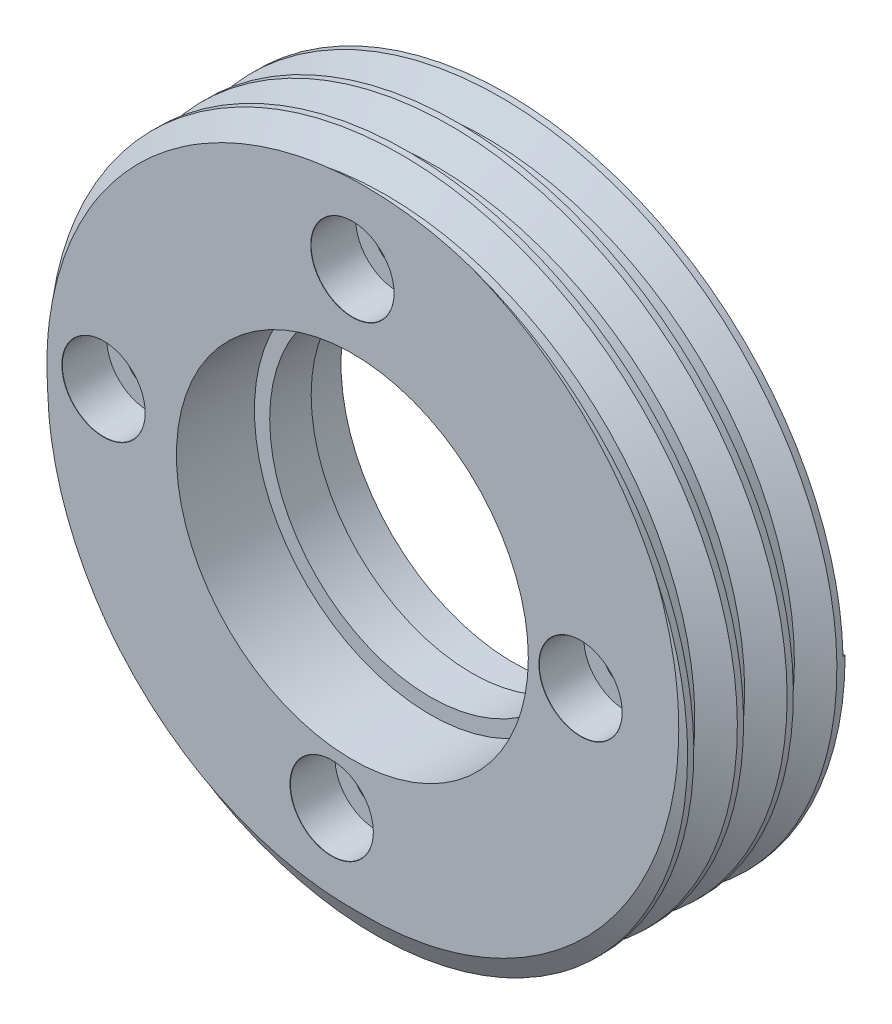
from build123d import *

# Parameters (mm, degrees)
SKETCH1_R                                    = 40
SKETCH1_R_2                                  = 20.7645
BOSS_EXTRUDE1_DEPTH                          = 5
SKETCH2_R                                    = 40
SKETCH2_R_2                                  = 19.3675
BOSS_EXTRUDE2_DEPTH                          = 5
SKETCH3_R                                    = 40
SKETCH3_R_2                                  = 21.209
BOSS_EXTRUDE3_DEPTH                          = 9.398
CBORE_FOR_M5_HEX_SOCKET_HEAD_CAP_SCR_2_COUNT = 2
CBORE_FOR_M5_HEX_SOCKET_HEAD_CAP_SCR_2_PITCH = 40.69705149
CBORE_FOR_M5_HEX_SOCKET_HEAD_CAP_SCR_3_COUNT = 2
CBORE_FOR_M5_HEX_SOCKET_HEAD_CAP_SCR_3_PITCH = 57.554322166
CBORE_FOR_M5_HEX_SOCKET_HEAD_CAP_SCR_4_COUNT = 2
CBORE_FOR_M5_HEX_SOCKET_HEAD_CAP_SCR_4_PITCH = 40.69705149
CBORE_FOR_M5_HEX_SOCKET_HEAD_CAP_SCR_5_COUNT = 2
CBORE_FOR_M5_HEX_SOCKET_HEAD_CAP_SCR_5_PITCH = 28.777161083
THREAD1_PITCH                                = 6


with BuildPart() as part:
    # Sketch1 → Boss-Extrude1 (new body)
    with BuildSketch(Plane.XY):
        Circle(SKETCH1_R)
        Circle(SKETCH1_R_2, mode=Mode.SUBTRACT)
    extrude(amount=BOSS_EXTRUDE1_DEPTH)

    # Sketch2 → Boss-Extrude2 (add)
    with BuildSketch(Plane.XY.offset(5)):
        Circle(SKETCH2_R)
        Circle(SKETCH2_R_2, mode=Mode.SUBTRACT)
    extrude(amount=BOSS_EXTRUDE2_DEPTH)

    # Sketch3 → Boss-Extrude3 (add)
    with BuildSketch(Plane.XY.offset(10)):
        Circle(SKETCH3_R)
        Circle(SKETCH3_R_2, mode=Mode.SUBTRACT)
    extrude(amount=BOSS_EXTRUDE3_DEPTH)

    # Sketch6 → CBORE for M5 Hex Socket Head Cap Screw1 (revolve, cut)
    with BuildSketch(Plane(origin=(0, 30, 19.398), x_dir=(0, -1, 0), z_dir=(1, 0, 0))):
        Polygon((0, 0), (0, 19.398), (2.75, 19.398), (2.75, 5.4), (5, 5.4), (5, 0.025), (5.025, 0), align=None)
    cbore_for_m5_hex_socket_head_cap_screw1 = revolve(axis=Axis((0, 30, 25.748), (0, 0, -1)), mode=Mode.SUBTRACT)

    # CBORE for M5 Hex Socket Head Cap Scr 2: CBORE for M5 Hex Socket Head Cap Screw1 ×2
    with Locations(*[Vector(0.675724628517345, -0.7371541402007425, 0) * (i * CBORE_FOR_M5_HEX_SOCKET_HEAD_CAP_SCR_2_PITCH) for i in range(1, CBORE_FOR_M5_HEX_SOCKET_HEAD_CAP_SCR_2_COUNT)]):
        add(cbore_for_m5_hex_socket_head_cap_screw1, mode=Mode.SUBTRACT)

    # CBORE for M5 Hex Socket Head Cap Scr 3: CBORE for M5 Hex Socket Head Cap Screw1 ×2
    with Locations(*[Vector(-0.04343722427630841, -0.9990561583550596, 0) * (i * CBORE_FOR_M5_HEX_SOCKET_HEAD_CAP_SCR_3_PITCH) for i in range(1, CBORE_FOR_M5_HEX_SOCKET_HEAD_CAP_SCR_3_COUNT)]):
        add(cbore_for_m5_hex_socket_head_cap_screw1, mode=Mode.SUBTRACT)

    # CBORE for M5 Hex Socket Head Cap Scr 4: CBORE for M5 Hex Socket Head Cap Screw1 ×2
    with Locations(*[Vector(-0.7371541402007423, -0.6757246285173454, 0) * (i * CBORE_FOR_M5_HEX_SOCKET_HEAD_CAP_SCR_4_PITCH) for i in range(1, CBORE_FOR_M5_HEX_SOCKET_HEAD_CAP_SCR_4_COUNT)]):
        add(cbore_for_m5_hex_socket_head_cap_screw1, mode=Mode.SUBTRACT)

    # CBORE for M5 Hex Socket Head Cap Scr 5: CBORE for M5 Hex Socket Head Cap Screw1 ×2
    with Locations(*[Vector(-0.04343722427630847, -0.9990561583550596, 0) * (i * CBORE_FOR_M5_HEX_SOCKET_HEAD_CAP_SCR_5_PITCH) for i in range(1, CBORE_FOR_M5_HEX_SOCKET_HEAD_CAP_SCR_5_COUNT)]):
        add(cbore_for_m5_hex_socket_head_cap_screw1, mode=Mode.SUBTRACT)

    # Thread1: arcs per turn and ends read off the stored shape
    # Thread1: the profile of Thread Profile1 profile screwed along a right-hand helix through 5 turns, 14 arcs to a turn; built about Z, then put on its axis
    thread1_z = Axis((0, 0, 0), (0, 0, 1))
    thread1_corners = [(40.0003, 0, -0.000173205), (40.0003, 0, 5.250173189), (36.75240475, 0, 3.374999992), (36.75240475, 0, 1.874999992)]
    with BuildLine(mode=Mode.PRIVATE) as thread1_profile:
        Line(thread1_corners[0], thread1_corners[1])
        Line(thread1_corners[1], thread1_corners[2])
        Line(thread1_corners[2], thread1_corners[3])
        Line(thread1_corners[3], thread1_corners[0])
    thread1_cap = Face(thread1_profile.wire())
    thread1_turn_angles = [0, 12.857142857, 25.714285714, 38.571428571, 51.428571429, 64.285714286, 77.142857143, 90, 102.857142857, 115.714285714, 128.571428571, 141.428571429, 154.285714286, 167.142857143, 180, 192.857142857, 205.714285714, 218.571428571, 231.428571429, 244.285714286, 257.142857143, 270, 282.857142857, 295.714285714, 308.571428571, 321.428571429, 334.285714286, 347.142857143, 360]
    thread1_turn_weights = [1, 0.9749279121818236, 1, 0.9749279121818236, 1, 0.9749279121818236, 1, 0.9749279121818236, 1, 0.9749279121818236, 1, 0.9749279121818236, 1, 0.9749279121818236, 1, 0.9749279121818236, 1, 0.9749279121818236, 1, 0.9749279121818236, 1, 0.9749279121818236, 1, 0.9749279121818237, 1, 0.9749279121818236, 1, 0.9749279121818236, 1]
    thread1_turn_rails = [Edge.make_bspline([Vector(p[0], p[1], 0).rotate(thread1_z, thread1_turn_angles[k]) / thread1_turn_weights[k] + Vector(0, 0, p[2] + THREAD1_PITCH * thread1_turn_angles[k] / 360) for k in range(29)], [0, 0, 0, 1, 1, 2, 2, 3, 3, 4, 4, 5, 5, 6, 6, 7, 7, 8, 8, 9, 9, 10, 10, 11, 11, 12, 12, 13, 13, 14, 14, 14], 2, thread1_turn_weights) for p in thread1_corners]
    thread1_turn_sides = [Face.make_surface_from_curves(thread1_turn_rails[p[0]], thread1_turn_rails[p[1]]) for p in [(0, 1), (1, 2), (2, 3), (3, 0)]]
    thread1 = Plane(origin=(0, 0, -5), x_dir=(1, 0, 0), z_dir=(0, 0, 1)) * Solid(Shell([*[p.moved(Location((0, 0, THREAD1_PITCH * i))) for i in range(5) for p in thread1_turn_sides], thread1_cap, thread1_cap.rotate(thread1_z, 1800).moved(Location((0, 0, THREAD1_PITCH * 1800 / 360)))]))
    add(thread1, mode=Mode.SUBTRACT)


solid = part.part
